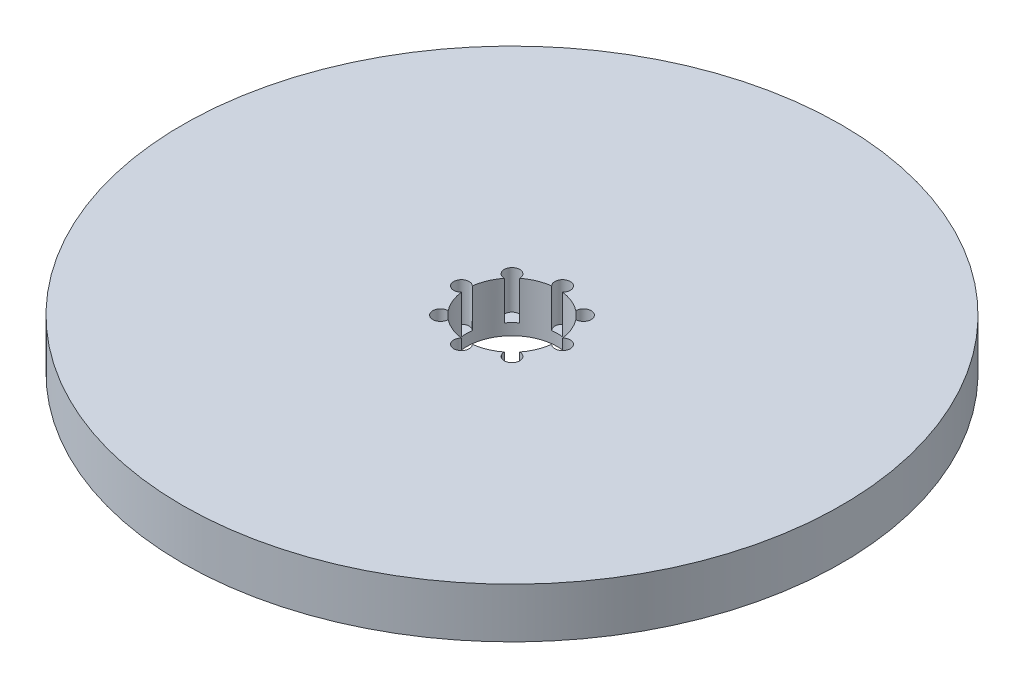
from build123d import *

# Parameters (mm, degrees)
SKETCH1_R           = 72.5
BOSS_EXTRUDE1_DEPTH = 11
SKETCH2_R           = 10
CUT_EXTRUDE1_DEPTH  = 104.118863454
SKETCH3_R           = 1.693821091
CUT_EXTRUDE2_DEPTH  = 8.497615315
CIRPATTERN1_COUNT   = 8


with BuildPart() as part:
    # Sketch1 → Boss-Extrude1 (new body)
    with BuildSketch(Plane(origin=(0, 0, 0), x_dir=(1, 0, 0), z_dir=(0, 1, 0))):
        Circle(SKETCH1_R)
    extrude(amount=BOSS_EXTRUDE1_DEPTH)

    # Sketch2 → Cut-Extrude1 (cut, through all)
    with BuildSketch(Plane(origin=(0, 0, 0), x_dir=(1, 0, 0), z_dir=(0, 1, 0))):
        Circle(SKETCH2_R)
    extrude(amount=CUT_EXTRUDE1_DEPTH, mode=Mode.SUBTRACT)

    # Sketch3 → Cut-Extrude2 (cut)
    with BuildSketch(Plane(origin=(0, 11, 0), x_dir=(1, 0, 0), z_dir=(0, 1, 0))):
        with Locations((-11.12529717, 0)):
            Circle(SKETCH3_R)
    cut_extrude2 = extrude(amount=-CUT_EXTRUDE2_DEPTH, mode=Mode.SUBTRACT)

    # CirPattern1: Cut-Extrude2 ×8 about axis
    cirpattern1_axis = Axis((0, 0, 0), (0, 1, 0))
    for i in range(1, CIRPATTERN1_COUNT):
        add(cut_extrude2.rotate(cirpattern1_axis, i * 360 / CIRPATTERN1_COUNT), mode=Mode.SUBTRACT)


solid = part.part
